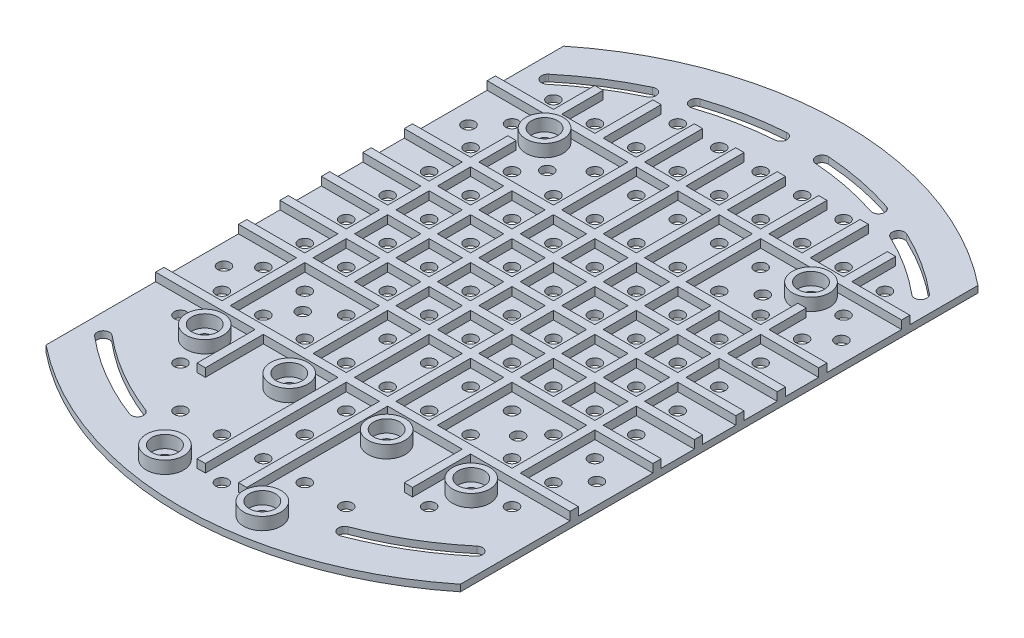
from build123d import *

# Parameters (mm, degrees)
SKETCH1_R               = 80
BOSS_EXTRUDE1_DEPTH     = 1.6
SKETCH2_W               = 30
SKETCH2_H               = 70
CUT_EXTRUDE1_DEPTH      = 1.6
FILLET1_R               = 3
FILLET1_OF_MIRROR1_R    = 3
CUT_EXTRUDE2_DEPTH      = 8.6
SKETCH5_R               = 1.5
CUT_EXTRUDE3_DEPTH      = 8.6
SKETCH6_R               = 1.5
CUT_EXTRUDE4_DEPTH      = 5
SKETCH7_R               = 1.5
CUT_EXTRUDE5_DEPTH      = 10
SKETCH8_W               = 100
SKETCH8_H               = 2
BOSS_EXTRUDE2_DEPTH     = 2
LPATTERN3_COUNT         = 3
LPATTERN3_PITCH         = 10
LPATTERN3_COUNT_DIR2    = 2
LPATTERN3_PITCH_DIR2    = 20
LPATTERN6_COUNT         = 2
LPATTERN6_PITCH         = 19
MIRROR3_COPY_1_SKETCH_R = 1.5
MIRROR3_COPY_1_DEPTH    = 5
LPATTERN4_COUNT         = 2
LPATTERN4_PITCH         = 40
LPATTERN4_COL_COUNT     = 2
LPATTERN4_COL_PITCH     = 40
SKETCH9_W               = 2
SKETCH9_H               = 130
BOSS_EXTRUDE3_DEPTH     = 2
SKETCH10_W              = 2
SKETCH10_H              = 110
BOSS_EXTRUDE4_DEPTH     = 2
LPATTERN5_COUNT         = 3
LPATTERN5_PITCH         = 10
MIRROR5_COPY_1_SKETCH_W = 2
MIRROR5_COPY_1_SKETCH_H = 110
MIRROR5_COPY_1_DEPTH    = 2
MIRROR5_COPY_2_SKETCH_W = 2
MIRROR5_COPY_2_SKETCH_H = 110
MIRROR5_COPY_2_DEPTH    = 2
SKETCH11_W              = 2
SKETCH11_H              = 4
SKETCH11_H_2            = 3.432070202
SKETCH11_H_3            = 14
CUT_EXTRUDE6_DEPTH      = 2
SKETCH13_W              = 15.867459237
SKETCH13_H              = 22.329650067
SKETCH13_W_2            = 17.077602432
SKETCH13_H_2            = 28.184676595
SKETCH13_W_3            = 30.459078353
SKETCH13_H_3            = 56.605392425
SKETCH13_W_4            = 36.014179162
SKETCH13_H_4            = 69.635705956
CUT_EXTRUDE8_DEPTH      = 10
SKETCH16_W              = 2
SKETCH16_H              = 14
SKETCH16_H_2            = 9
CUT_EXTRUDE9_DEPTH      = 2
SKETCH17_R              = 1.5
CUT_EXTRUDE10_DEPTH     = 10
SKETCH18_R              = 4.5
SKETCH18_R_2            = 3.15
BOSS_EXTRUDE5_DEPTH     = 3
SKETCH19_W              = 2
SKETCH19_H              = 18
CUT_EXTRUDE11_DEPTH     = 2


with BuildPart() as part:
    # Sketch1 → Boss-Extrude1 (new body)
    with BuildSketch(Plane(origin=(0, 0, 0), x_dir=(1, 0, 0), z_dir=(0, 1, 0))):
        with Locations(Location((0, 0, 0), (0, 0, 270))):
            Circle(SKETCH1_R)
    extrude(amount=BOSS_EXTRUDE1_DEPTH)

    # Sketch2 → Cut-Extrude1 (cut)
    with BuildSketch(Plane(origin=(0, 1.6, 0), x_dir=(1, 0, 0), z_dir=(0, 1, 0))):
        with Locations((-65, 15)):
            Rectangle(SKETCH2_W, SKETCH2_H)
    cut_extrude1 = extrude(amount=-CUT_EXTRUDE1_DEPTH, mode=Mode.SUBTRACT)

    # Fillet1
    fillet1_edges = [part.edges().sort_by_distance(p)[0] for p in [
        (-62.449979984, 0.8, -50),
        (-77.459666924, 0.8, 20),
        (-50, 0.8, 20),
        (-50, 0.8, -50),
    ]]
    fillet(fillet1_edges, radius=FILLET1_R)

    # Mirror1: Cut-Extrude1 across plane
    add(cut_extrude1.mirror(Plane(origin=(0, 0, 0), x_dir=(0, 0, 1), z_dir=(1, 0, 0))), mode=Mode.SUBTRACT)

    # Fillet1 of Mirror1
    fillet1_of_mirror1_edges = [part.edges().sort_by_distance(p)[0] for p in [
        (62.449979984, 0.8, -50),
        (77.459666924, 0.8, 20),
        (50, 0.8, 20),
        (50, 0.8, -50),
    ]]
    fillet(fillet1_of_mirror1_edges, radius=FILLET1_OF_MIRROR1_R)

    # Sketch3 → Cut-Extrude2 (cut)
    with BuildSketch(Plane(origin=(0, 1.6, 0), x_dir=(1, 0, 0), z_dir=(0, 1, 0))):
        with BuildLine():
            ThreePointArc((-25.535714286, -66.784558814), (-23.59892534, -65.919198439), (-24.464285714, -63.982409493))
            ThreePointArc((-24.464285714, -63.982409493), (-34.7303343, -59.042813952), (-44.035714286, -52.470047335))
            ThreePointArc((-44.035714286, -52.470047335), (-46.148979139, -52.65474076), (-45.964285714, -54.768005613))
            ThreePointArc((-45.964285714, -54.768005613), (-36.251370839, -61.628630622), (-25.535714286, -66.784558814))
        make_face()
        with BuildLine():
            ThreePointArc((-53.625, -47.292804685), (-51.507843258, -47.425647944), (-51.375, -45.308491202))
            ThreePointArc((-51.375, -45.308491202), (-58.344419, -35.891207441), (-63.607142857, -25.424031497))
            ThreePointArc((-63.607142857, -25.424031497), (-65.556730617, -24.587904971), (-66.392857143, -26.53749273))
            ThreePointArc((-66.392857143, -26.53749273), (-60.899649029, -37.463085139), (-53.625, -47.292804685))
        make_face()
        with BuildLine():
            ThreePointArc((-4.892857143, 68.325031643), (-13.313111244, 67.193832076), (-21.528571429, 65.028998241))
            ThreePointArc((-21.528571429, 65.028998241), (-23.423992662, 65.981562332), (-22.471428571, 67.876983566))
            ThreePointArc((-22.471428571, 67.876983566), (-13.89616721, 70.136627641), (-5.107142857, 71.317368795))
            ThreePointArc((-5.107142857, 71.317368795), (-3.503831424, 69.928343076), (-4.892857143, 68.325031643))
        make_face()
        with BuildLine():
            ThreePointArc((-29.357142857, 61.890291349), (-28.644738146, 63.888410346), (-30.642857143, 64.600815058))
            ThreePointArc((-30.642857143, 64.600815058), (-38.617801848, 60.174042414), (-45.964285714, 54.768005613))
            ThreePointArc((-45.964285714, 54.768005613), (-46.148979139, 52.65474076), (-44.035714286, 52.470047335))
            ThreePointArc((-44.035714286, 52.470047335), (-36.997474498, 57.649257417), (-29.357142857, 61.890291349))
        make_face()
    cut_extrude2 = extrude(amount=-CUT_EXTRUDE2_DEPTH, mode=Mode.SUBTRACT)

    # Mirror2: Cut-Extrude2 across plane
    add(cut_extrude2.mirror(Plane(origin=(0, 0, 0), x_dir=(0, 0, 1), z_dir=(1, 0, 0))), mode=Mode.SUBTRACT)

    # Sketch5 → Cut-Extrude3 (cut)
    with BuildSketch(Plane(origin=(0, 1.6, 0), x_dir=(1, 0, 0), z_dir=(0, 1, 0))):
        with Locations(Location((11.75, -42, 0), (0, 0, 270))):
            Circle(SKETCH5_R)
        with Locations(Location((-11.75, -42, 0), (0, 0, 270))):
            Circle(SKETCH5_R)
        with Locations(Location((-11.75, -72, 0), (0, 0, 270))):
            Circle(SKETCH5_R)
        with Locations(Location((11.75, -72, 0), (0, 0, 270))):
            Circle(SKETCH5_R)
    extrude(amount=-CUT_EXTRUDE3_DEPTH, mode=Mode.SUBTRACT)

    # Sketch6 → Cut-Extrude4 (cut, symmetric)
    with BuildSketch(Plane(origin=(0, 1.6, 0), x_dir=(1, 0, 0), z_dir=(0, 1, 0))):
        with Locations(Location((-45, 34.5, 0), (0, 0, 270))):
            Circle(SKETCH6_R)
        with Locations(Location((-45, -24.5, 0), (0, 0, 270))):
            Circle(SKETCH6_R)
    cut_extrude4 = extrude(amount=CUT_EXTRUDE4_DEPTH, both=True, mode=Mode.SUBTRACT)

    # Sketch7 → Cut-Extrude5 (cut)
    with BuildSketch(Plane(origin=(0, 1.6, 0), x_dir=(1, 0, 0), z_dir=(0, 1, 0))):
        with Locations(Location((0, -10, 0), (0, 0, 270))):
            Circle(SKETCH7_R)
        with Locations(Location((0, 0, 0), (0, 0, 270))):
            Circle(SKETCH7_R)
        with Locations(Location((0, 10, 0), (0, 0, 270))):
            Circle(SKETCH7_R)
        with Locations(Location((0, 20, 0), (0, 0, 270))):
            Circle(SKETCH7_R)
        with Locations(Location((0, 30, 0), (0, 0, 270))):
            Circle(SKETCH7_R)
        with Locations(Location((0, 40, 0), (0, 0, 270))):
            Circle(SKETCH7_R)
        with Locations(Location((0, 50, 0), (0, 0, 270))):
            Circle(SKETCH7_R)
        with Locations(Location((0, 60, 0), (0, 0, 270))):
            Circle(SKETCH7_R)
        with Locations(Location((0, -20, 0), (0, 0, 270))):
            Circle(SKETCH7_R)
        with Locations(Location((0, -30, 0), (0, 0, 270))):
            Circle(SKETCH7_R)
        with Locations(Location((0, -40, 0), (0, 0, 270))):
            Circle(SKETCH7_R)
        with Locations(Location((0, -50, 0), (0, 0, 270))):
            Circle(SKETCH7_R)
        with Locations(Location((0, -60, 0), (0, 0, 270))):
            Circle(SKETCH7_R)
        with Locations(Location((0, -70, 0), (0, 0, 270))):
            Circle(SKETCH7_R)
        with Locations(Location((10, 60, 0), (0, 0, 270))):
            Circle(SKETCH7_R)
        with Locations(Location((10, 50, 0), (0, 0, 270))):
            Circle(SKETCH7_R)
        with Locations(Location((10, 40, 0), (0, 0, 270))):
            Circle(SKETCH7_R)
        with Locations(Location((10, 30, 0), (0, 0, 270))):
            Circle(SKETCH7_R)
        with Locations(Location((10, 20, 0), (0, 0, 270))):
            Circle(SKETCH7_R)
        with Locations(Location((10, 10, 0), (0, 0, 270))):
            Circle(SKETCH7_R)
        with Locations(Location((10, 0, 0), (0, 0, 270))):
            Circle(SKETCH7_R)
        with Locations(Location((10, -10, 0), (0, 0, 270))):
            Circle(SKETCH7_R)
        with Locations(Location((10, -20, 0), (0, 0, 270))):
            Circle(SKETCH7_R)
        with Locations(Location((10, -30, 0), (0, 0, 270))):
            Circle(SKETCH7_R)
        with Locations(Location((10, -60, 0), (0, 0, 270))):
            Circle(SKETCH7_R)
        with Locations(Location((20, 60, 0), (0, 0, 270))):
            Circle(SKETCH7_R)
        with Locations(Location((20, 50, 0), (0, 0, 270))):
            Circle(SKETCH7_R)
        with Locations(Location((20, 40, 0), (0, 0, 270))):
            Circle(SKETCH7_R)
        with Locations(Location((20, 30, 0), (0, 0, 270))):
            Circle(SKETCH7_R)
        with Locations(Location((20, 20, 0), (0, 0, 270))):
            Circle(SKETCH7_R)
        with Locations(Location((20, 10, 0), (0, 0, 270))):
            Circle(SKETCH7_R)
        with Locations(Location((20, 0, 0), (0, 0, 270))):
            Circle(SKETCH7_R)
        with Locations(Location((20, -10, 0), (0, 0, 270))):
            Circle(SKETCH7_R)
        with Locations(Location((20, -20, 0), (0, 0, 270))):
            Circle(SKETCH7_R)
        with Locations(Location((20, -30, 0), (0, 0, 270))):
            Circle(SKETCH7_R)
        with Locations(Location((20, -60, 0), (0, 0, 270))):
            Circle(SKETCH7_R)
        with Locations(Location((-10, 60, 0), (0, 0, 270))):
            Circle(SKETCH7_R)
        with Locations(Location((-10, 50, 0), (0, 0, 270))):
            Circle(SKETCH7_R)
        with Locations(Location((-10, 40, 0), (0, 0, 270))):
            Circle(SKETCH7_R)
        with Locations(Location((-10, 30, 0), (0, 0, 270))):
            Circle(SKETCH7_R)
        with Locations(Location((-10, 20, 0), (0, 0, 270))):
            Circle(SKETCH7_R)
        with Locations(Location((-10, 10, 0), (0, 0, 270))):
            Circle(SKETCH7_R)
        with Locations(Location((-10, 0, 0), (0, 0, 270))):
            Circle(SKETCH7_R)
        with Locations(Location((-10, -10, 0), (0, 0, 270))):
            Circle(SKETCH7_R)
        with Locations(Location((-10, -20, 0), (0, 0, 270))):
            Circle(SKETCH7_R)
        with Locations(Location((-10, -30, 0), (0, 0, 270))):
            Circle(SKETCH7_R)
        with Locations(Location((-10, -60, 0), (0, 0, 270))):
            Circle(SKETCH7_R)
        with Locations(Location((-20, 60, 0), (0, 0, 270))):
            Circle(SKETCH7_R)
        with Locations(Location((-20, 50, 0), (0, 0, 270))):
            Circle(SKETCH7_R)
        with Locations(Location((-20, 40, 0), (0, 0, 270))):
            Circle(SKETCH7_R)
        with Locations(Location((-20, 30, 0), (0, 0, 270))):
            Circle(SKETCH7_R)
        with Locations(Location((-20, 20, 0), (0, 0, 270))):
            Circle(SKETCH7_R)
        with Locations(Location((-20, 10, 0), (0, 0, 270))):
            Circle(SKETCH7_R)
        with Locations(Location((-20, 0, 0), (0, 0, 270))):
            Circle(SKETCH7_R)
        with Locations(Location((-20, -10, 0), (0, 0, 270))):
            Circle(SKETCH7_R)
        with Locations(Location((-20, -20, 0), (0, 0, 270))):
            Circle(SKETCH7_R)
        with Locations(Location((-20, -30, 0), (0, 0, 270))):
            Circle(SKETCH7_R)
        with Locations(Location((-20, -60, 0), (0, 0, 270))):
            Circle(SKETCH7_R)
        with Locations(Location((-30, 50, 0), (0, 0, 270))):
            Circle(SKETCH7_R)
        with Locations(Location((-30, 30, 0), (0, 0, 270))):
            Circle(SKETCH7_R)
        with Locations(Location((-30, 20, 0), (0, 0, 270))):
            Circle(SKETCH7_R)
        with Locations(Location((-30, 10, 0), (0, 0, 270))):
            Circle(SKETCH7_R)
        with Locations(Location((-30, 0, 0), (0, 0, 270))):
            Circle(SKETCH7_R)
        with Locations(Location((-30, -10, 0), (0, 0, 270))):
            Circle(SKETCH7_R)
        with Locations(Location((-30, -20, 0), (0, 0, 270))):
            Circle(SKETCH7_R)
        with Locations(Location((-30, -30, 0), (0, 0, 270))):
            Circle(SKETCH7_R)
        with Locations(Location((-40, 50, 0), (0, 0, 270))):
            Circle(SKETCH7_R)
        with Locations(Location((-40, 40, 0), (0, 0, 270))):
            Circle(SKETCH7_R)
        with Locations(Location((-40, 30, 0), (0, 0, 270))):
            Circle(SKETCH7_R)
        with Locations(Location((-40, 20, 0), (0, 0, 270))):
            Circle(SKETCH7_R)
        with Locations(Location((-40, 10, 0), (0, 0, 270))):
            Circle(SKETCH7_R)
        with Locations(Location((-40, 0, 0), (0, 0, 270))):
            Circle(SKETCH7_R)
        with Locations(Location((-40, -10, 0), (0, 0, 270))):
            Circle(SKETCH7_R)
        with Locations(Location((-40, -20, 0), (0, 0, 270))):
            Circle(SKETCH7_R)
        with Locations(Location((-40, -30, 0), (0, 0, 270))):
            Circle(SKETCH7_R)
        with Locations(Location((30, 50, 0), (0, 0, 270))):
            Circle(SKETCH7_R)
        with Locations(Location((30, 30, 0), (0, 0, 270))):
            Circle(SKETCH7_R)
        with Locations(Location((30, 20, 0), (0, 0, 270))):
            Circle(SKETCH7_R)
        with Locations(Location((30, 10, 0), (0, 0, 270))):
            Circle(SKETCH7_R)
        with Locations(Location((30, 0, 0), (0, 0, 270))):
            Circle(SKETCH7_R)
        with Locations(Location((30, -10, 0), (0, 0, 270))):
            Circle(SKETCH7_R)
        with Locations(Location((30, -20, 0), (0, 0, 270))):
            Circle(SKETCH7_R)
        with Locations(Location((30, -30, 0), (0, 0, 270))):
            Circle(SKETCH7_R)
        with Locations(Location((40, 50, 0), (0, 0, 270))):
            Circle(SKETCH7_R)
        with Locations(Location((40, 40, 0), (0, 0, 270))):
            Circle(SKETCH7_R)
        with Locations(Location((40, 30, 0), (0, 0, 270))):
            Circle(SKETCH7_R)
        with Locations(Location((40, 20, 0), (0, 0, 270))):
            Circle(SKETCH7_R)
        with Locations(Location((40, 10, 0), (0, 0, 270))):
            Circle(SKETCH7_R)
        with Locations(Location((40, 0, 0), (0, 0, 270))):
            Circle(SKETCH7_R)
        with Locations(Location((40, -10, 0), (0, 0, 270))):
            Circle(SKETCH7_R)
        with Locations(Location((40, -20, 0), (0, 0, 270))):
            Circle(SKETCH7_R)
        with Locations(Location((40, -30, 0), (0, 0, 270))):
            Circle(SKETCH7_R)
        with Locations(Location((-40, -40, 0), (0, 0, 270))):
            Circle(SKETCH7_R)
        with Locations(Location((40, -40, 0), (0, 0, 270))):
            Circle(SKETCH7_R)
        with Locations(Location((-30, -50, 0), (0, 0, 270))):
            Circle(SKETCH7_R)
        with Locations(Location((30, -50, 0), (0, 0, 270))):
            Circle(SKETCH7_R)
    extrude(amount=-CUT_EXTRUDE5_DEPTH, mode=Mode.SUBTRACT)

    # Sketch8 → Boss-Extrude2 (add)
    with BuildSketch(Plane(origin=(0, 1.6, 0), x_dir=(1, 0, 0), z_dir=(0, 1, 0))):
        with Locations((0, 5)):
            Rectangle(SKETCH8_W, SKETCH8_H)
    boss_extrude2 = extrude(amount=BOSS_EXTRUDE2_DEPTH)

    # LPattern3: Boss-Extrude2 3 × 2
    with Locations(*[Vector(0, 0, -1) * (i * LPATTERN3_PITCH) + Vector(0, 0, 1) * (j * LPATTERN3_PITCH_DIR2) for i in range(LPATTERN3_COUNT) for j in range(LPATTERN3_COUNT_DIR2) if (i, j) != (0, 0)]):
        add(boss_extrude2)

    # LPattern6: Cut-Extrude4 ×2
    with Locations(*[(i * LPATTERN6_PITCH, 0, 0) for i in range(1, LPATTERN6_COUNT)]):
        add(cut_extrude4, mode=Mode.SUBTRACT)

    # Mirror3: Cut-Extrude4 across plane
    add(cut_extrude4.mirror(Plane(origin=(0, 0, 0), x_dir=(0, 0, 1), z_dir=(1, 0, 0))), mode=Mode.SUBTRACT)

    # Mirror3 copy 1 sketch → Mirror3 copy 1 (cut, symmetric)
    with BuildSketch(Plane(origin=(-19, 1.6, 0), x_dir=(-1, 0, 0), z_dir=(0, 1, 0))):
        with Locations((-45, -34.5)):
            Circle(MIRROR3_COPY_1_SKETCH_R)
        with Locations((-45, 24.5)):
            Circle(MIRROR3_COPY_1_SKETCH_R)
    extrude(amount=MIRROR3_COPY_1_DEPTH, both=True, mode=Mode.SUBTRACT)

    # LPattern4: Boss-Extrude2 ×2
    with Locations(*[(0, 0, -i * LPATTERN4_PITCH) for i in range(1, LPATTERN4_COUNT)]):
        add(boss_extrude2)

    # LPattern4 col: Boss-Extrude2 ×2
    with Locations(*[(0, 0, i * LPATTERN4_COL_PITCH) for i in range(1, LPATTERN4_COL_COUNT)]):
        add(boss_extrude2)

    # Sketch9 → Boss-Extrude3 (add)
    with BuildSketch(Plane(origin=(0, 1.6, 0), x_dir=(1, 0, 0), z_dir=(0, 1, 0))):
        with Locations((5, -5)):
            Rectangle(SKETCH9_W, SKETCH9_H)
    boss_extrude3 = extrude(amount=BOSS_EXTRUDE3_DEPTH)

    # Mirror4: Boss-Extrude3 across plane
    add(boss_extrude3.mirror(Plane(origin=(0, 0, 0), x_dir=(0, 0, 1), z_dir=(1, 0, 0))))

    # Sketch10 → Boss-Extrude4 (add)
    with BuildSketch(Plane(origin=(0, 1.6, 0), x_dir=(1, 0, 0), z_dir=(0, 1, 0))):
        with Locations((-15, 5)):
            Rectangle(SKETCH10_W, SKETCH10_H)
    boss_extrude4 = extrude(amount=BOSS_EXTRUDE4_DEPTH)

    # LPattern5: Boss-Extrude4 ×3
    with Locations(*[(-i * LPATTERN5_PITCH, 0, 0) for i in range(1, LPATTERN5_COUNT)]):
        add(boss_extrude4)

    # Mirror5: Boss-Extrude4 across plane
    add(boss_extrude4.mirror(Plane(origin=(0, 0, 0), x_dir=(0, 0, 1), z_dir=(1, 0, 0))))

    # Mirror5 copy 1 sketch → Mirror5 copy 1 (add)
    with BuildSketch(Plane(origin=(10, 1.6, 0), x_dir=(-1, 0, 0), z_dir=(0, 1, 0))):
        with Locations((-15, -5)):
            Rectangle(MIRROR5_COPY_1_SKETCH_W, MIRROR5_COPY_1_SKETCH_H)
    extrude(amount=MIRROR5_COPY_1_DEPTH)

    # Mirror5 copy 2 sketch → Mirror5 copy 2 (add)
    with BuildSketch(Plane(origin=(20, 1.6, 0), x_dir=(-1, 0, 0), z_dir=(0, 1, 0))):
        with Locations((-15, -5)):
            Rectangle(MIRROR5_COPY_2_SKETCH_W, MIRROR5_COPY_2_SKETCH_H)
    extrude(amount=MIRROR5_COPY_2_DEPTH)

    # Sketch11 → Cut-Extrude6 (cut)
    with BuildSketch(Plane(origin=(0, 3.6, 0), x_dir=(1, 0, 0), z_dir=(0, 1, 0))):
        with Locations((-35, 58)):
            Rectangle(SKETCH11_W, SKETCH11_H)
        with Locations((35, 58.283964899)):
            Rectangle(SKETCH11_W, SKETCH11_H_2)
        with Locations((15, -43)):
            Rectangle(SKETCH11_W, SKETCH11_H_3)
        with Locations((-15, -43)):
            Rectangle(SKETCH11_W, SKETCH11_H_3)
    extrude(amount=-CUT_EXTRUDE6_DEPTH, mode=Mode.SUBTRACT)

    # Sketch13 → Cut-Extrude8 (cut)
    with BuildSketch(Plane(origin=(0, 1.6, 0), x_dir=(1, 0, 0), z_dir=(0, 1, 0))):
        with Locations((-57.933729619, 58.164825034)):
            Rectangle(SKETCH13_W, SKETCH13_H)
        with Locations((58.538801216, 60.092338297)):
            Rectangle(SKETCH13_W_2, SKETCH13_H_2)
        with Locations((65.229539176, -44.302696213)):
            Rectangle(SKETCH13_W_3, SKETCH13_H_3)
        with Locations((-68.007089581, -51.817852978)):
            Rectangle(SKETCH13_W_4, SKETCH13_H_4)
    extrude(amount=-CUT_EXTRUDE8_DEPTH, mode=Mode.SUBTRACT)

    # Sketch16 → Cut-Extrude9 (cut)
    with BuildSketch(Plane(origin=(0, 3.6, 0), x_dir=(1, 0, 0), z_dir=(0, 1, 0))):
        with Locations((-35, -43)):
            Rectangle(SKETCH16_W, SKETCH16_H)
        with Locations((35, -43)):
            Rectangle(SKETCH16_W, SKETCH16_H)
        with Locations((-35, 39.5)):
            Rectangle(SKETCH16_W, SKETCH16_H_2)
        with Locations((35, 39.5)):
            Rectangle(SKETCH16_W, SKETCH16_H_2)
    extrude(amount=-CUT_EXTRUDE9_DEPTH, mode=Mode.SUBTRACT)

    # Sketch17 → Cut-Extrude10 (cut)
    with BuildSketch(Plane(origin=(0, 1.6, 0), x_dir=(1, 0, 0), z_dir=(0, 1, 0))):
        with Locations(Location((32.15, 40, 0), (0, 0, 270))):
            Circle(SKETCH17_R)
        with Locations(Location((32.15, -42, 0), (0, 0, 270))):
            Circle(SKETCH17_R)
    cut_extrude10 = extrude(amount=-CUT_EXTRUDE10_DEPTH, mode=Mode.SUBTRACT)

    # Mirror6: Cut-Extrude10 across plane
    add(cut_extrude10.mirror(Plane(origin=(0, 0, 0), x_dir=(0, 0, 1), z_dir=(1, 0, 0))), mode=Mode.SUBTRACT)

    # Sketch18 → Boss-Extrude5 (add)
    # profile 1 of 4: a face of its own
    with BuildSketch(Plane(origin=(0, 1.6, 0), x_dir=(1, 0, 0), z_dir=(0, 1, 0))):
        with Locations(Location((11.75, -72, 0), (0, 0, 270))):
            Circle(SKETCH18_R)
        with Locations(Location((11.75, -72, 0), (0, 0, 270))):
            Circle(SKETCH18_R_2, mode=Mode.SUBTRACT)
    # profile 2 of 4: a face of its own
    with BuildSketch(Plane(origin=(0, 1.6, 0), x_dir=(1, 0, 0), z_dir=(0, 1, 0))):
        with Locations(Location((11.75, -42, 0), (0, 0, 270))):
            Circle(SKETCH18_R)
        with Locations(Location((11.75, -42, 0), (0, 0, 270))):
            Circle(SKETCH18_R_2, mode=Mode.SUBTRACT)
    # profile 3 of 4: a face of its own
    with BuildSketch(Plane(origin=(0, 1.6, 0), x_dir=(1, 0, 0), z_dir=(0, 1, 0))):
        with Locations(Location((32.15, -42, 0), (0, 0, 270))):
            Circle(SKETCH18_R)
        with Locations(Location((32.15, -42, 0), (0, 0, 270))):
            Circle(SKETCH18_R_2, mode=Mode.SUBTRACT)
    # profile 4 of 4: a face of its own
    with BuildSketch(Plane(origin=(0, 1.6, 0), x_dir=(1, 0, 0), z_dir=(0, 1, 0))):
        with Locations(Location((32.15, 40, 0), (0, 0, 62.733955549))):
            Circle(SKETCH18_R)
        with Locations(Location((32.15, 40, 0), (0, 0, 270))):
            Circle(SKETCH18_R_2, mode=Mode.SUBTRACT)
    boss_extrude5 = extrude(amount=BOSS_EXTRUDE5_DEPTH)

    # Mirror7: Boss-Extrude5 across plane
    add(boss_extrude5.mirror(Plane(origin=(0, 0, 0), x_dir=(0, 0, 1), z_dir=(1, 0, 0))))

    # Sketch19 → Cut-Extrude11 (cut)
    with BuildSketch(Plane(origin=(0, 3.6, 0), x_dir=(1, 0, 0), z_dir=(0, 1, 0))):
        with Locations((-25, 35)):
            Rectangle(SKETCH19_W, SKETCH19_H)
        with Locations((25, 35)):
            Rectangle(SKETCH19_W, SKETCH19_H)
        with Locations((25, -25)):
            Rectangle(SKETCH19_W, SKETCH19_H)
        with Locations((-25, -25)):
            Rectangle(SKETCH19_W, SKETCH19_H)
    extrude(amount=-CUT_EXTRUDE11_DEPTH, mode=Mode.SUBTRACT)


solid = part.part
